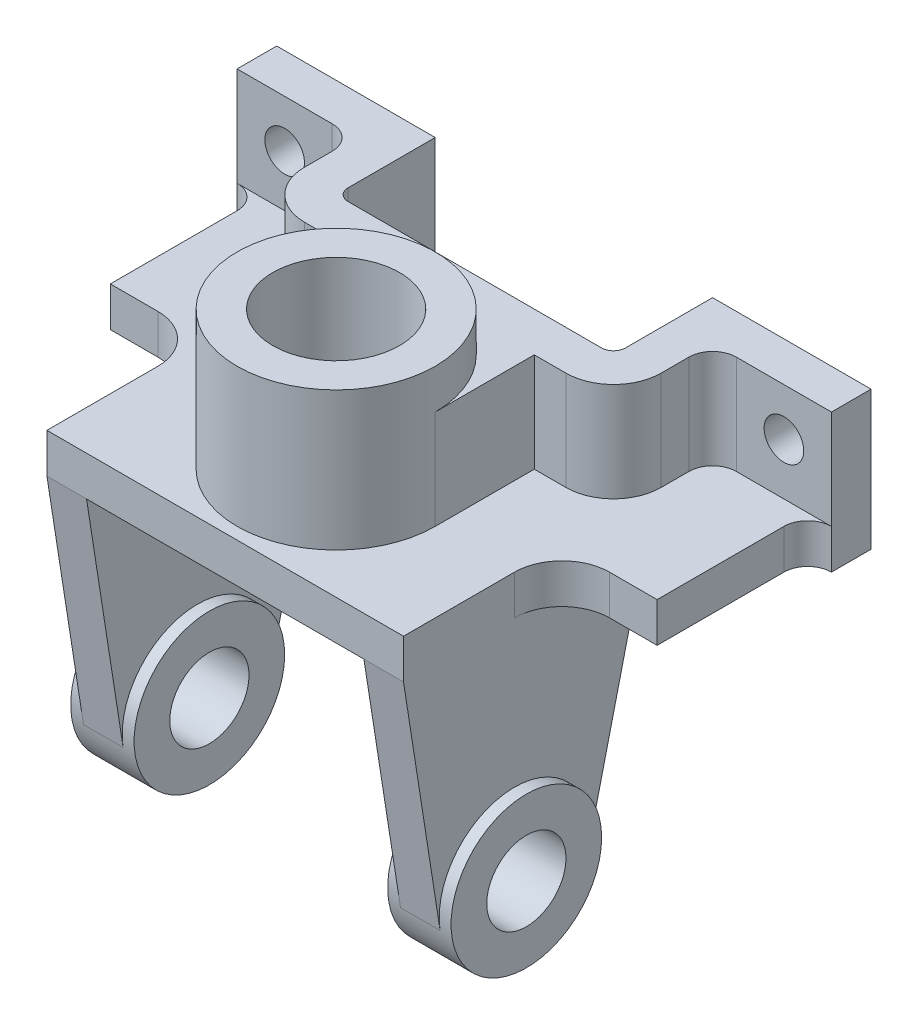
from build123d import *

# Parameters (mm, degrees)
EXTRUDE_1_DEPTH     = 10
FILLET_1_R          = 12
FILLET_2_R          = 6
EXTRUDE_2_DEPTH     = 25
EXTRUDE_3_DEPTH     = 35
SKETCH_2_4_W        = 70
SKETCH_2_4_H        = 25
CUT_EXTRUDE_1_DEPTH = 35
FILLET_3_R          = 6
FILLET_4_R          = 12
FILLET_5_R          = 3
CUT_EXTRUDE_START   = -35
CUT_EXTRUDE_2_DEPTH = 35
EXTRUDE_START       = 35
EXTRUDE_4_DEPTH     = 10
EXTRUDE_START_2     = 32
SKETCH_6_4_R        = 19
SKETCH_6_4_R_2      = 10
EXTRUDE_5_DEPTH     = 16
SKETCH_7_R          = 5
CUT_EXTRUDE_3_DEPTH = 144.506097431


with BuildPart() as part:
    # 草图1 → 凸台-拉伸1 (new body)
    with BuildSketch(Plane(origin=(0, 0, 0), x_dir=(1, 0, 0), z_dir=(0, 1, 0))):
        Polygon((45, 0), (45, 40), (69, 40), (69, 78), (75, 78), (75, 88), (-75, 88), (-75, 78), (-69, 78), (-69, 40), (-45, 40), (-45, 0), align=None)
    extrude(amount=-EXTRUDE_1_DEPTH)

    # 圆角1
    fillet_1_edges = [part.edges().sort_by_distance(p)[0] for p in [
        (-45, -5, -40),
        (45, -5, -40),
    ]]
    fillet(fillet_1_edges, radius=FILLET_1_R)

    # 圆角2
    fillet_2_edges = [part.edges().sort_by_distance(p)[0] for p in [
        (69, -5, -78),
        (-69, -5, -78),
    ]]
    fillet(fillet_2_edges, radius=FILLET_2_R - 0.0001)  # a hair under: the kernel refuses the full size

    # 草图2 → 凸台-拉伸2 (add)
    with BuildSketch(Plane(origin=(0, 0, 0), x_dir=(1, 0, 0), z_dir=(0, 1, 0))):
        with BuildLine():
            Line((-25, 53), (-25, 28))
            ThreePointArc((-25, 28), (-17.67766953, 45.67766953), (0, 53))
            Line((0, 53), (0, 63))
            Line((0, 63), (-35, 63))
            Line((-35, 63), (-35, 88))
            Line((-35, 88), (-75, 88))
            Line((-75, 88), (-75, 78))
            Line((-75, 78), (-45, 78))
            Line((-45, 78), (-45, 53))
            Line((-45, 53), (-25, 53))
        make_face()
        with BuildLine():
            ThreePointArc((0, 53), (17.67766953, 45.67766953), (25, 28))
            Line((25, 28), (25, 53))
            Line((25, 53), (45, 53))
            Line((45, 53), (45, 78))
            Line((45, 78), (75, 78))
            Line((75, 78), (75, 88))
            Line((75, 88), (35, 88))
            Line((35, 88), (35, 63))
            Line((35, 63), (0, 63))
            Line((0, 63), (0, 53))
        make_face()
    extrude(amount=EXTRUDE_2_DEPTH)

    # 草图2<3> → 凸台-拉伸3 (add)
    with BuildSketch(Plane(origin=(0, 0, 0), x_dir=(1, 0, 0), z_dir=(0, 1, 0))):
        with BuildLine():
            ThreePointArc((-25, 28), (-17.67766953, 10.32233047), (0, 3))
            Line((0, 3), (0, 12))
            ThreePointArc((0, 12), (-16, 28), (0, 44))
            Line((0, 44), (0, 53))
            ThreePointArc((0, 53), (-17.67766953, 45.67766953), (-25, 28))
        make_face()
        with BuildLine():
            Line((0, 12), (0, 3))
            ThreePointArc((0, 3), (17.67766953, 10.32233047), (25, 28))
            ThreePointArc((25, 28), (17.67766953, 45.67766953), (0, 53))
            Line((0, 53), (0, 44))
            ThreePointArc((0, 44), (11.313708499, 39.313708499), (16, 28))
            ThreePointArc((16, 28), (11.313708499, 16.686291501), (0, 12))
        make_face()
    extrude(amount=EXTRUDE_3_DEPTH)

    # 草图2<4> → 切除-拉伸1 (cut)
    with BuildSketch(Plane(origin=(0, 0, 0), x_dir=(1, 0, 0), z_dir=(0, 1, 0))):
        with Locations((0, 75.5)):
            Rectangle(SKETCH_2_4_W, SKETCH_2_4_H)
    extrude(amount=-CUT_EXTRUDE_1_DEPTH, mode=Mode.SUBTRACT)

    # 圆角3
    fillet_3_edges = [part.edges().sort_by_distance(p)[0] for p in [
        (45, 12.5, -78),
        (-45, 12.5, -78),
    ]]
    fillet(fillet_3_edges, radius=FILLET_3_R)

    # 圆角4
    fillet_4_edges = [part.edges().sort_by_distance(p)[0] for p in [
        (45, 12.5, -53),
        (-45, 12.5, -53),
    ]]
    fillet(fillet_4_edges, radius=FILLET_4_R)

    # 圆角5
    fillet_5_edges = [part.edges().sort_by_distance(p)[0] for p in [
        (35, 7.5, -63),
        (-35, 7.5, -63),
    ]]
    fillet(fillet_5_edges, radius=FILLET_5_R)

    # 草图2<5> → 切除-拉伸2 (cut)
    with BuildSketch(Plane(origin=(0, 0, 0), x_dir=(1, 0, 0), z_dir=(0, 1, 0)).offset(CUT_EXTRUDE_START)):
        with BuildLine():
            ThreePointArc((0, 44), (-16, 28), (0, 12))
            Line((0, 12), (0, 44))
        make_face()
        with BuildLine():
            Line((0, 44), (0, 12))
            ThreePointArc((0, 12), (11.313708499, 16.686291501), (16, 28))
            ThreePointArc((16, 28), (11.313708499, 39.313708499), (0, 44))
        make_face()
    extrude(amount=CUT_EXTRUDE_2_DEPTH, mode=Mode.SUBTRACT)

    # 草图6 → 凸台-拉伸4 (add)
    with BuildSketch(Plane(origin=(0, 0, 0), x_dir=(0, 0, -1), z_dir=(1, 0, 0)).offset(EXTRUDE_START)):
        with BuildLine():
            Line((0, -10), (9.228717941, -68.939212458))
            ThreePointArc((9.228717941, -68.939212458), (26.525951004, -47.057265785), (47, -66))
            ThreePointArc((47, -66), (46.868026287, -68.235527685), (46.473938523, -70.439999487))
            Line((46.473938523, -70.439999487), (56.431805566, -29.007331733))
            Line((56.431805566, -29.007331733), (61, -10))
            Line((61, -10), (0, -10))
        make_face()
    extrude_4 = extrude(amount=EXTRUDE_4_DEPTH)

    # 草图6<4> → 凸台-拉伸5 (add)
    with BuildSketch(Plane(origin=(0, 0, 0), x_dir=(0, 0, -1), z_dir=(1, 0, 0)).offset(EXTRUDE_START_2)):
        with Locations((28, -66)):
            Circle(SKETCH_6_4_R)
        with Locations((28, -66)):
            Circle(SKETCH_6_4_R_2, mode=Mode.SUBTRACT)
    extrude_5 = extrude(amount=EXTRUDE_5_DEPTH)

    # 镜向1: 凸台-拉伸4, 凸台-拉伸5 across plane
    add(extrude_4.mirror(Plane(origin=(0, 0, 0), x_dir=(0, 0, 1), z_dir=(1, 0, 0))))
    add(extrude_5.mirror(Plane(origin=(0, 0, 0), x_dir=(0, 0, 1), z_dir=(1, 0, 0))))

    # 草图7 → 切除-拉伸3 (cut, through all)
    with BuildSketch(Plane.XY):
        with Locations((-63, 13)):
            Circle(SKETCH_7_R)
    cut_extrude_3 = extrude(amount=-CUT_EXTRUDE_3_DEPTH, mode=Mode.SUBTRACT)

    # 镜向2: 切除-拉伸3 across plane
    add(cut_extrude_3.mirror(Plane(origin=(0, 0, 0), x_dir=(0, 0, 1), z_dir=(1, 0, 0))), mode=Mode.SUBTRACT)


solid = part.part
